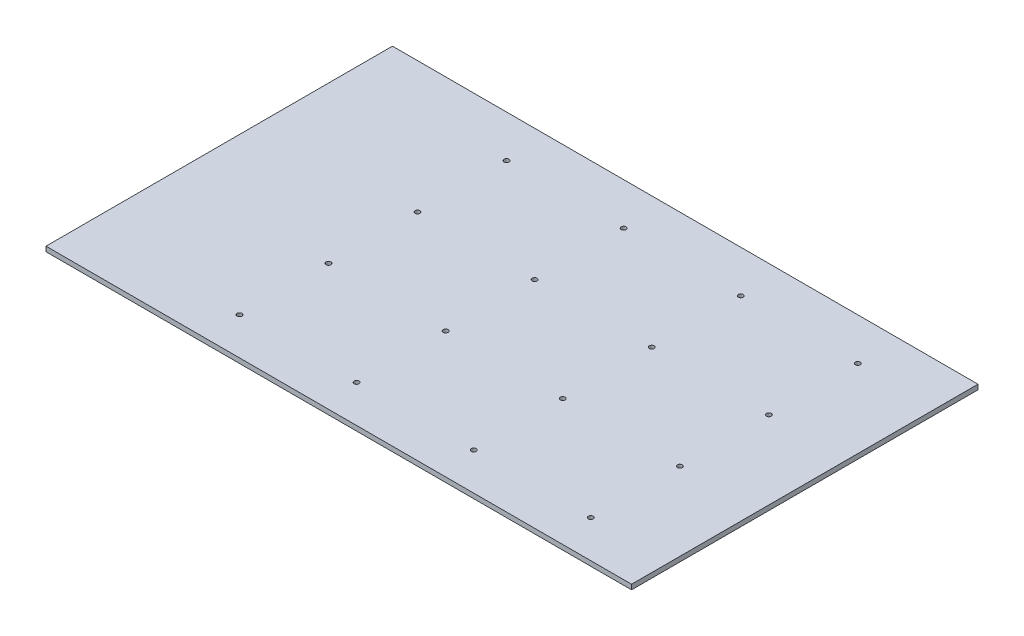
from build123d import *

# Parameters (mm, degrees)
SKETCH1_W           = 762
SKETCH1_H           = 450.85
BOSS_EXTRUDE1_DEPTH = 6.35
SKETCH2_R           = 3.175
CUT_EXTRUDE1_DEPTH  = 6.35


with BuildPart() as part:
    # Sketch1 → Boss-Extrude1 (new body)
    with BuildSketch(Plane(origin=(0, 0, 0), x_dir=(1, 0, 0), z_dir=(0, 1, 0))):
        with Locations((381, 225.425)):
            Rectangle(SKETCH1_W, SKETCH1_H)
    extrude(amount=BOSS_EXTRUDE1_DEPTH)

    # Sketch2 → Cut-Extrude1 (cut)
    with BuildSketch(Plane(origin=(0, 6.35, 0), x_dir=(1, 0, 0), z_dir=(0, 1, 0))):
        with Locations((203.2, 396.0876)):
            Circle(SKETCH2_R)
        with Locations((355.6, 396.0876)):
            Circle(SKETCH2_R)
        with Locations((508, 396.0876)):
            Circle(SKETCH2_R)
        with Locations((660.4, 396.0876)):
            Circle(SKETCH2_R)
        with Locations((203.2, 280.2636)):
            Circle(SKETCH2_R)
        with Locations((355.6, 280.2636)):
            Circle(SKETCH2_R)
        with Locations((508, 280.2636)):
            Circle(SKETCH2_R)
        with Locations((660.4, 280.2636)):
            Circle(SKETCH2_R)
        with Locations((203.2, 164.4396)):
            Circle(SKETCH2_R)
        with Locations((355.6, 164.4396)):
            Circle(SKETCH2_R)
        with Locations((508, 164.4396)):
            Circle(SKETCH2_R)
        with Locations((660.4, 164.4396)):
            Circle(SKETCH2_R)
        with Locations((203.2, 48.6156)):
            Circle(SKETCH2_R)
        with Locations((355.6, 48.6156)):
            Circle(SKETCH2_R)
        with Locations((508, 48.6156)):
            Circle(SKETCH2_R)
        with Locations((660.4, 48.6156)):
            Circle(SKETCH2_R)
    extrude(amount=-CUT_EXTRUDE1_DEPTH, mode=Mode.SUBTRACT)


solid = part.part
